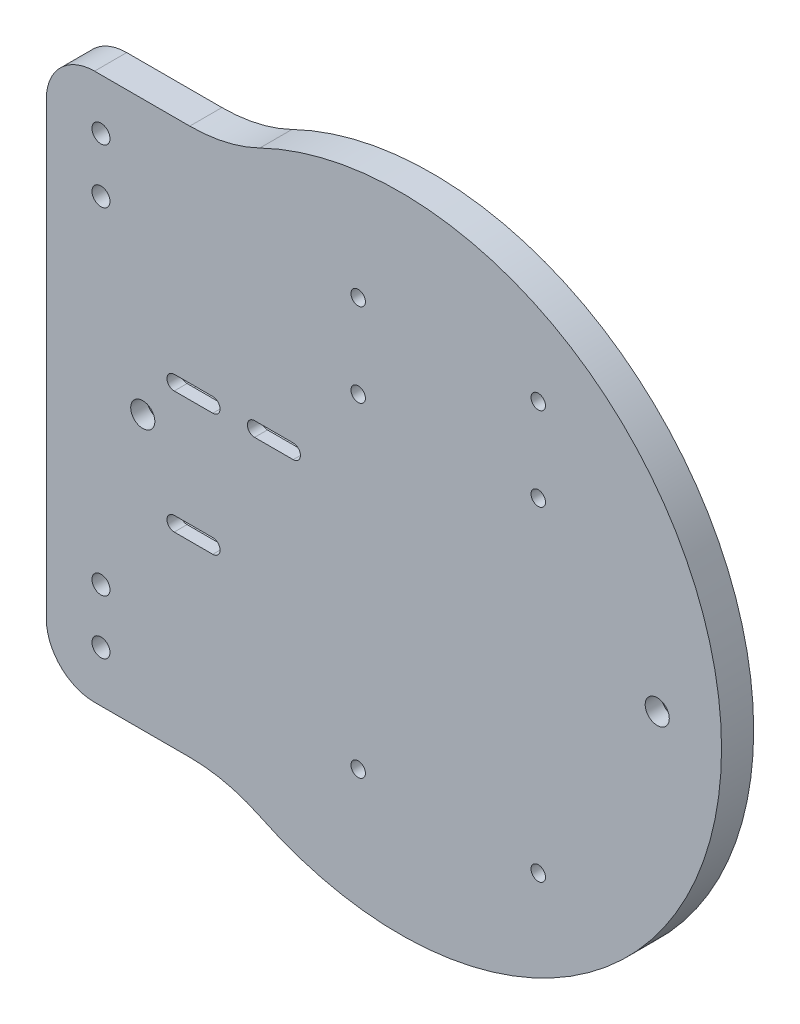
from build123d import *

# Parameters (mm, degrees)
SALIENTE_EXTRUIR2_DEPTH                              = 10
REDONDEO3_R                                          = 15
REDONDEO5_R                                          = 50
CROQUIS4_R                                           = 2.8
CROQUIS4_R_2                                         = 2.799999999
CROQUIS4_R_3                                         = 2.25
CORTAR_EXTRUIR1_DEPTH                                = 149.996644258
REFRENTADO_PARA_TORNILLO_CON_CABEZA_TRON_D           = 4.5
REFRENTADO_PARA_TORNILLO_CON_CABEZA_TRON_CBORE_D     = 7.5
REFRENTADO_PARA_TORNILLO_CON_CABEZA_TRON_CBORE_DEPTH = 5
CORTAR_EXTRUIR2_DEPTH                                = 6


with BuildPart() as part:
    # Croquis2 → Saliente-Extruir2 (new body)
    with BuildSketch(Plane(origin=(0, 0, 0), x_dir=(0, 1, 0), z_dir=(0, 0, 1))):
        with BuildLine():
            Line((-85, 52.678268764), (-85, 110))
            Line((-85, 110), (85, 110))
            Line((85, 110), (85, 52.678268764))
            ThreePointArc((85, 52.678268764), (0, -100), (-85, 52.678268764))
        make_face()
    extrude(amount=SALIENTE_EXTRUIR2_DEPTH)

    # Redondeo3
    redondeo3_edges = [part.edges().sort_by_distance(p)[0] for p in [
        (-110, 85, 5),
        (-110, -85, 5),
    ]]
    fillet(redondeo3_edges, radius=REDONDEO3_R)

    # Redondeo5
    redondeo5_edges = [part.edges().sort_by_distance(p)[0] for p in [
        (-52.678268764, 85, 5),
        (-52.678268764, -85, 5),
    ]]
    fillet(redondeo5_edges, radius=REDONDEO5_R)

    # Croquis4 → Cortar-Extruir1 (cut, through all)
    with BuildSketch(Plane.XY.offset(10)):
        with Locations((-92.999999999, 69.2)):
            Circle(CROQUIS4_R)
        with Locations((-92.999999999, 52.279001067)):
            Circle(CROQUIS4_R)
        with Locations((-92.999999999, -52.279001068)):
            Circle(CROQUIS4_R_2)
        with Locations((-92.999999999, -69.2)):
            Circle(CROQUIS4_R)
        with Locations((-13, 39)):
            Circle(CROQUIS4_R_3)
        with Locations((43, 39)):
            Circle(CROQUIS4_R_3)
        with Locations((-13, 65)):
            Circle(CROQUIS4_R_3)
        with Locations((43, 65)):
            Circle(CROQUIS4_R_3)
        with Locations((-13, -62)):
            Circle(CROQUIS4_R_3)
        with Locations((43, -62)):
            Circle(CROQUIS4_R_3)
        with BuildLine():
            Line((-58.219532094, 11.25), (-70.219532094, 11.25))
            ThreePointArc((-70.219532094, 11.25), (-72.469532094, 13.5), (-70.219532094, 15.75))
            Line((-70.219532094, 15.75), (-58.219532094, 15.75))
            ThreePointArc((-58.219532094, 15.75), (-55.969532094, 13.5), (-58.219532094, 11.25))
        make_face()
        with BuildLine():
            Line((-33.219532094, 11.25), (-45.219532094, 11.25))
            ThreePointArc((-45.219532094, 11.25), (-47.469532094, 13.5), (-45.219532094, 15.75))
            Line((-45.219532094, 15.75), (-33.219532094, 15.75))
            ThreePointArc((-33.219532094, 15.75), (-30.969532094, 13.5), (-33.219532094, 11.25))
        make_face()
        with BuildLine():
            Line((-58.219532094, -26.75), (-70.219532094, -26.75))
            ThreePointArc((-70.219532094, -26.75), (-72.469532094, -24.5), (-70.219532094, -22.25))
            Line((-70.219532094, -22.25), (-58.219532094, -22.25))
            ThreePointArc((-58.219532094, -22.25), (-55.969532094, -24.5), (-58.219532094, -26.75))
        make_face()
    extrude(amount=-CORTAR_EXTRUIR1_DEPTH, mode=Mode.SUBTRACT)

    # Refrentado para tornillo con cabeza troncocónica de M41 (through all)
    with Locations(Plane.XY.offset(10)):
        with Locations((-80, 0), (80, 0)):
            CounterBoreHole(REFRENTADO_PARA_TORNILLO_CON_CABEZA_TRON_D / 2, REFRENTADO_PARA_TORNILLO_CON_CABEZA_TRON_CBORE_D / 2, REFRENTADO_PARA_TORNILLO_CON_CABEZA_TRON_CBORE_DEPTH)

    # Croquis7 → Cortar-Extruir2 (cut)
    with BuildSketch(Plane(origin=(0, 0, 0), x_dir=(1, 0, 0), z_dir=(0, 0, -1))):
        with BuildLine():
            Line((-70.219532094, 29), (-58.219532094, 29))
            ThreePointArc((-58.219532094, 29), (-53.719532094, 24.5), (-58.219532094, 20))
            Line((-58.219532094, 20), (-70.219532094, 20))
            ThreePointArc((-70.219532094, 20), (-74.719532094, 24.5), (-70.219532094, 29))
        make_face()
        with BuildLine():
            Line((-70.219532094, -9), (-58.219532094, -9))
            ThreePointArc((-58.219532094, -9), (-53.719532094, -13.5), (-58.219532094, -18))
            Line((-58.219532094, -18), (-70.219532094, -18))
            ThreePointArc((-70.219532094, -18), (-74.719532094, -13.5), (-70.219532094, -9))
        make_face()
        with BuildLine():
            Line((-45.219532094, -9), (-33.219532094, -9))
            ThreePointArc((-33.219532094, -9), (-28.719532094, -13.5), (-33.219532094, -18))
            Line((-33.219532094, -18), (-45.219532094, -18))
            ThreePointArc((-45.219532094, -18), (-49.719532094, -13.5), (-45.219532094, -9))
        make_face()
    extrude(amount=-CORTAR_EXTRUIR2_DEPTH, mode=Mode.SUBTRACT)


solid = part.part
